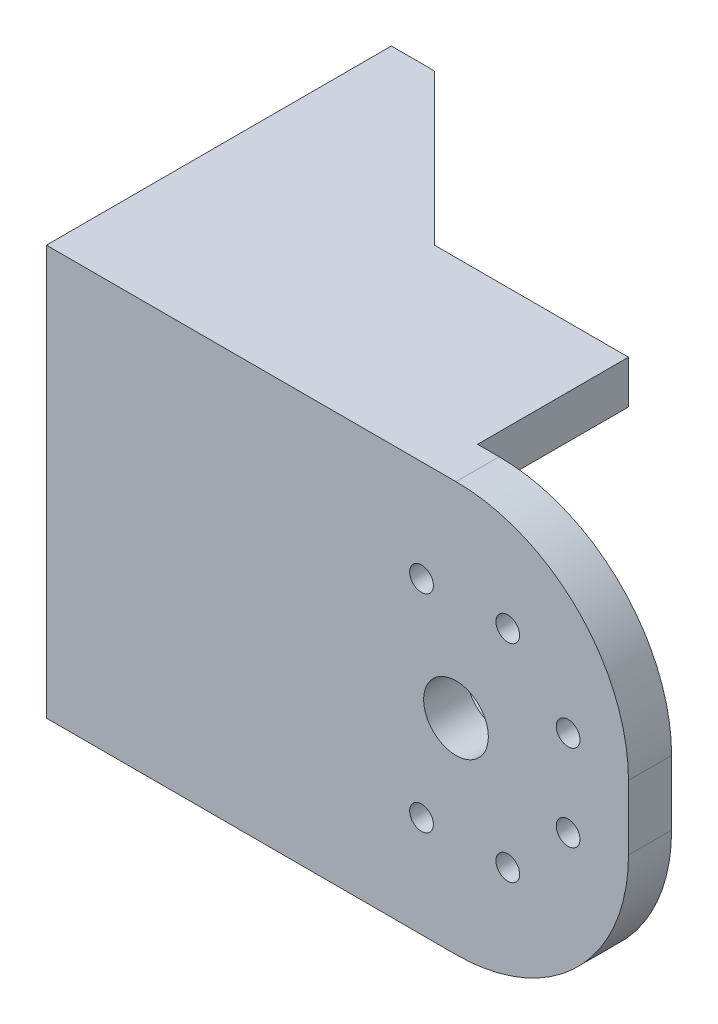
from build123d import *

# Parameters (mm, degrees)
SKETCH3_R           = 7.5
SKETCH3_R_2         = 2.75
BOSS_EXTRUDE1_DEPTH = 10
SKETCH4_W           = 10
SKETCH4_H           = 95
BOSS_EXTRUDE2_DEPTH = 70
SKETCH5_W           = 80
SKETCH5_H           = 10
BOSS_EXTRUDE3_DEPTH = 35
SKETCH8_R           = 7.5
SKETCH8_R_2         = 2.75
CUT_EXTRUDE2_DEPTH  = 43.8
CHAMFER1_SIZE       = 35


with BuildPart() as part:
    # Sketch3 → Boss-Extrude1 (new body)
    with BuildSketch(Plane.XY):
        with BuildLine():
            Line((68.617133813, 80.05993294), (163.617133813, 80.05993294))
            ThreePointArc((163.617133813, 80.05993294), (191.90140506, 68.344204188), (203.617133813, 40.05993294))
            Line((203.617133813, 40.05993294), (203.617133813, 25.05993294))
            ThreePointArc((203.617133813, 25.05993294), (191.90140506, -3.224338307), (163.617133813, -14.94006706))
            Line((163.617133813, -14.94006706), (68.617133813, -14.94006706))
            Line((68.617133813, -14.94006706), (68.617133813, 80.05993294))
        make_face()
        with Locations((163.617133813, 32.55993294)):
            Circle(SKETCH3_R, mode=Mode.SUBTRACT)
        with Locations((189.617133813, 42.55993294)):
            Circle(SKETCH3_R_2, mode=Mode.SUBTRACT)
        with Locations((155.617133813, 56.55993294)):
            Circle(SKETCH3_R_2, mode=Mode.SUBTRACT)
        with Locations((175.617133813, 56.55993294)):
            Circle(SKETCH3_R_2, mode=Mode.SUBTRACT)
        with Locations((155.617133813, 8.55993294)):
            Circle(SKETCH3_R_2, mode=Mode.SUBTRACT)
        with Locations((175.617133813, 8.55993294)):
            Circle(SKETCH3_R_2, mode=Mode.SUBTRACT)
        with Locations((189.617133813, 22.55993294)):
            Circle(SKETCH3_R_2, mode=Mode.SUBTRACT)
    extrude(amount=BOSS_EXTRUDE1_DEPTH)

    # Sketch4 → Boss-Extrude2 (add)
    with BuildSketch(Plane(origin=(0, 0, 0), x_dir=(-1, 0, 0), z_dir=(0, 0, -1))):
        with Locations((-73.617133813, 32.55993294)):
            Rectangle(SKETCH4_W, SKETCH4_H)
    extrude(amount=BOSS_EXTRUDE2_DEPTH)

    # Sketch5 → Boss-Extrude3 (add)
    with BuildSketch(Plane(origin=(0, 0, 0), x_dir=(-1, 0, 0), z_dir=(0, 0, -1))):
        with Locations((-118.617133813, 75.05993294)):
            Rectangle(SKETCH5_W, SKETCH5_H)
        with Locations((-118.617133813, -9.94006706)):
            Rectangle(SKETCH5_W, SKETCH5_H)
    extrude(amount=BOSS_EXTRUDE3_DEPTH)

    # Sketch8 → Cut-Extrude2 (cut)
    with BuildSketch(Plane.ZY.offset(-68.617133813)):
        with Locations(Location((-40, 32.55993294, 0), (0, 0, 270))):
            Circle(SKETCH8_R)
        with Locations(Location((-56.167891819, 25.862972874, 0), (0, 0, 270))):
            Circle(SKETCH8_R_2)
        with Locations(Location((-56.167891819, 39.256893006, 0), (0, 0, 270))):
            Circle(SKETCH8_R_2)
        with Locations(Location((-46.696960066, 48.727824759, 0), (0, 0, 270))):
            Circle(SKETCH8_R_2)
        with Locations(Location((-33.303039934, 48.727824759, 0), (0, 0, 270))):
            Circle(SKETCH8_R_2)
        with Locations(Location((-23.832108181, 39.256893006, 0), (0, 0, 270))):
            Circle(SKETCH8_R_2)
        with Locations(Location((-23.832108181, 25.862972874, 0), (0, 0, 270))):
            Circle(SKETCH8_R_2)
        with Locations(Location((-33.303039934, 16.392041121, 0), (0, 0, 270))):
            Circle(SKETCH8_R_2)
        with Locations(Location((-46.696960066, 16.392041121, 0), (0, 0, 270))):
            Circle(SKETCH8_R_2)
    extrude(amount=-CUT_EXTRUDE2_DEPTH, mode=Mode.SUBTRACT)

    # Chamfer1
    chamfer1_edges = [part.edges().sort_by_distance(p)[0] for p in [
        (78.617133813, 75.05993294, -35),
        (78.617133813, -9.94006706, -35),
    ]]
    chamfer(chamfer1_edges, length=CHAMFER1_SIZE - 0.0001)  # a hair under: the kernel refuses the full size


solid = part.part
